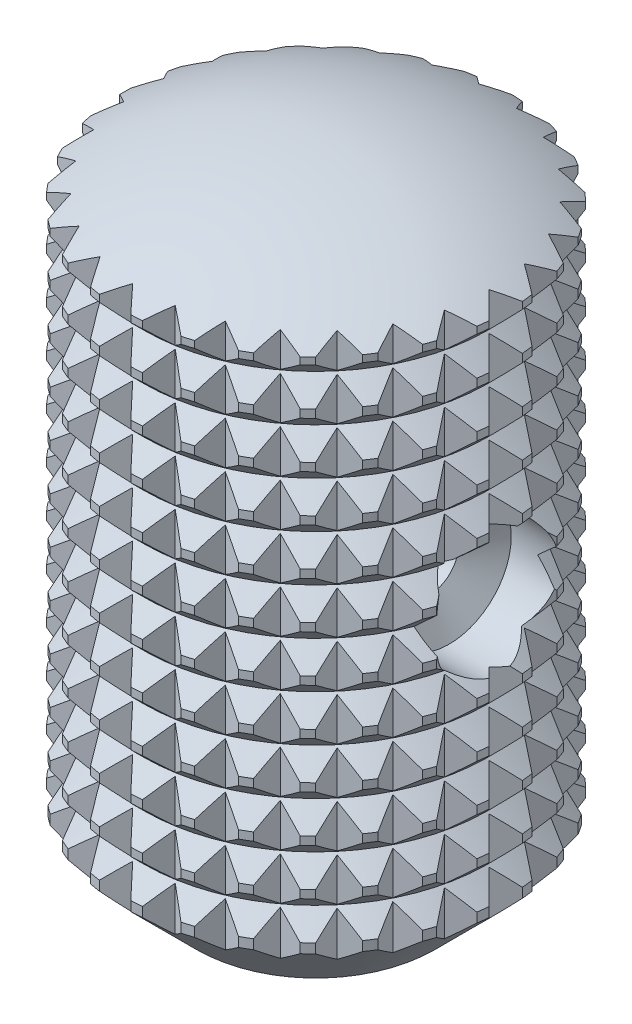
from build123d import *

# Parameters (mm, degrees)
SKETCH1_R                      = 4
BOSS_EXTRUDE1_DEPTH            = 6.75
CHAMFER1_SIZE                  = 1.5
F_2_5_2_5_DIAMETER_HOLE1_D     = 2.5
F_2_5_2_5_DIAMETER_HOLE1_DEPTH = 11
F_2_5_2_5_DIAMETER_HOLE1_TIP   = 0.751075774
LPATTERN1_COUNT                = 11
LPATTERN1_PITCH                = 0.97
CUT_EXTRUDE2_DEPTH             = 9.806957644
CIRPATTERN2_COUNT              = 27


# Read off the part's stored shape, not the designer's step: CSK for M1.4 Countersunk Flat Head Screw1
with BuildPart() as part:
    # Sketch1 → Boss-Extrude1 (new, symmetric)
    with BuildSketch(Plane(origin=(0, 0, 0), x_dir=(1, 0, 0), z_dir=(0, 1, 0))):
        with Locations(Location((0, 0, 0), (0, 0, 270))):
            Circle(SKETCH1_R)
    extrude(amount=BOSS_EXTRUDE1_DEPTH, both=True)

    # Chamfer1
    chamfer1_edges = [part.edges().sort_by_distance(p)[0] for p in [
        (0, -6.75, -4),
    ]]
    chamfer(chamfer1_edges, length=CHAMFER1_SIZE)

    # Sketch2 → Cut-Revolve1 (revolve, cut)
    with BuildSketch(Plane.XY, mode=Mode.PRIVATE) as cut_revolve1_sk:
        with BuildLine():
            Line((0, 6.75), (0, 7.75))
            Line((0, 7.75), (4, 7.75))
            Line((4, 7.75), (4, 5.59428877))
            ThreePointArc((4, 5.59428877), (2.081806214, 6.455281597), (0, 6.75))
        make_face()
    revolve(cut_revolve1_sk.sketch.rotate(Axis((0, 0, 0), (0, 1, 0)), 90), axis=Axis((0, 0, 0), (0, 1, 0)), mode=Mode.SUBTRACT)

    # Ø2.5 (2.5) Diameter Hole1
    with Locations(Plane(origin=(0, -6.75, 0), x_dir=(-1, 0, 0), z_dir=(0, -1, 0))):
        with Locations((0, 0)):
            Hole(F_2_5_2_5_DIAMETER_HOLE1_D / 2, depth=F_2_5_2_5_DIAMETER_HOLE1_DEPTH)
            with Locations((0, 0, -(F_2_5_2_5_DIAMETER_HOLE1_DEPTH + F_2_5_2_5_DIAMETER_HOLE1_TIP / 2))):  # 118° drill point
                Cone(0, F_2_5_2_5_DIAMETER_HOLE1_D / 2, F_2_5_2_5_DIAMETER_HOLE1_TIP, mode=Mode.SUBTRACT)

    # CSK for M1.4 Countersunk Flat Head S 2 → CSK for M1.4 Countersunk Flat Head Screw1 (revolve, cut)
    with BuildSketch(Plane(origin=(0, 0.25, 0), x_dir=(0, 1, 0), z_dir=(0, 0, -1))):
        Polygon((0.6, 2.395854812), (1.3, 2.8), (1.3, 4.000027419), (0, 4.000027419), (0, 1.096517587), (0.6, 1.096517587), align=None)
    revolve(axis=Axis((0, 0.25, 0), (1, 0, 0)), mode=Mode.SUBTRACT)

    # Sketch3 → Cut-Revolve2 (revolve, cut)
    with BuildSketch(Plane.XY, mode=Mode.PRIVATE) as cut_revolve2_sk:
        Polygon((-4, -5.05), (-3.6, -4.65), (-4, -4.25), align=None)
    cut_revolve2 = revolve(cut_revolve2_sk.sketch.rotate(Axis((0, 0, 0), (0, -1, 0)), 180), axis=Axis((0, 0, 0), (0, -1, 0)), mode=Mode.SUBTRACT)

    # LPattern1: Cut-Revolve2 ×11
    with Locations(*[(0, i * LPATTERN1_PITCH, 0) for i in range(1, LPATTERN1_COUNT)]):
        add(cut_revolve2, mode=Mode.SUBTRACT)

    # Sketch4 → Cut-Extrude2 (cut, symmetric)
    with BuildSketch(Plane(origin=(0, 0, 0), x_dir=(1, 0, 0), z_dir=(0, 1, 0))):
        with BuildLine():
            Line((3.635143711, 0), (3.984697267, 0.349553556))
            ThreePointArc((3.984697267, 0.349553556), (4, 0), (3.984697267, -0.349553556))
            Line((3.984697267, -0.349553556), (3.635143711, 0))
        make_face()
    cut_extrude2 = extrude(amount=CUT_EXTRUDE2_DEPTH, both=True, mode=Mode.SUBTRACT)

    # CirPattern2: Cut-Extrude2 ×27 about axis
    cirpattern2_axis = Axis((0, 0, 0), (0, 1, 0))
    for i in range(1, CIRPATTERN2_COUNT):
        add(cut_extrude2.rotate(cirpattern2_axis, i * 360 / CIRPATTERN2_COUNT), mode=Mode.SUBTRACT)


solid = part.part
